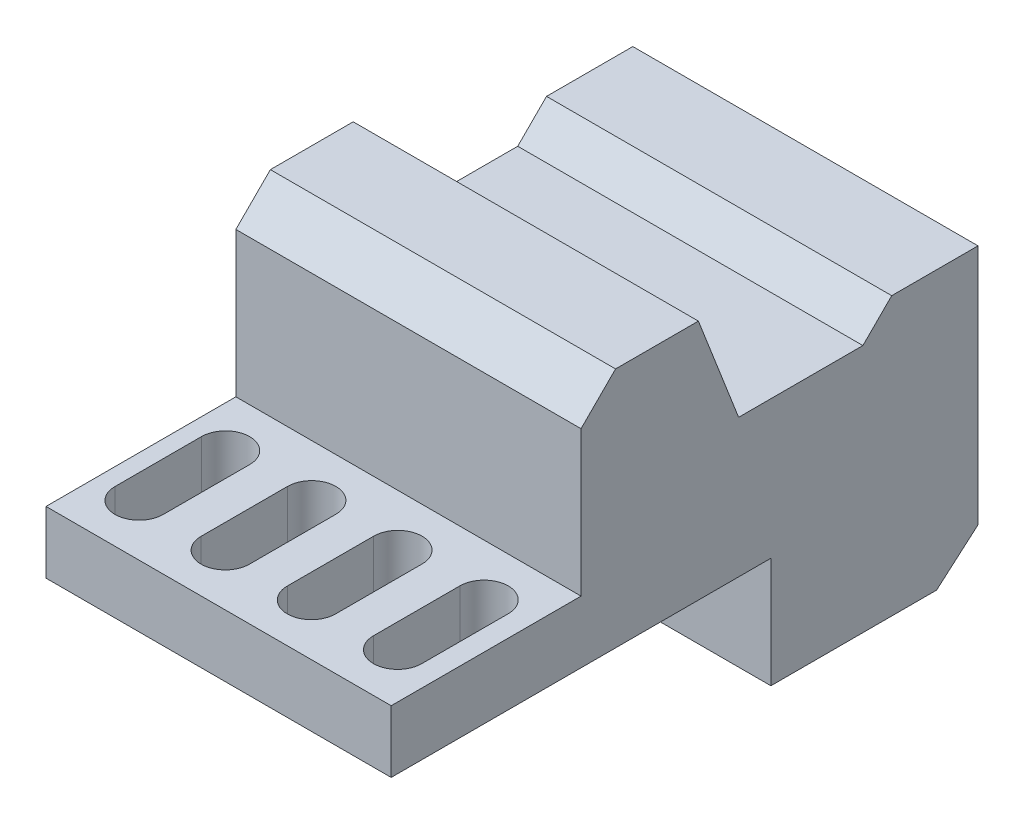
from build123d import *

# Parameters (mm, degrees)
RESSALTO_EXTRUS_O1_DEPTH = 100
CORTE_EXTRUS_O1_DEPTH    = 204.970201133


with BuildPart() as part:
    # Esboço3 → Ressalto-extrusão1 (new body)
    with BuildSketch(Plane(origin=(0, 0, 0), x_dir=(0, 0, -1), z_dir=(1, 0, 0))):
        Polygon((0, 0), (0, -70), (-12, -80.38), (-60, -80.38), (-60, -48.378489886), (-170, -48.378489886), (-170, -30.378489886), (-115, -30.378489886), (-115, 11.621510114), (-105.001510114, 21.62), (-81.001510114, 21.62), (-69.343860018, -8.343860018), (-33.343860018, -8.343860018), (-25, 0), align=None)
    extrude(amount=RESSALTO_EXTRUS_O1_DEPTH)

    # Esboço5 → Corte-extrusão1 (cut, through all)
    with BuildSketch(Plane(origin=(0, -30.378489886, 0), x_dir=(1, 0, 0), z_dir=(0, 1, 0))):
        with BuildLine():
            Line((5, -155.02), (5, -129.98))
            ThreePointArc((5, -129.98), (12, -122.98), (19, -129.98))
            Line((19, -129.98), (19, -155.02))
            ThreePointArc((19, -155.02), (12, -162.02), (5, -155.02))
        make_face()
        with BuildLine():
            Line((29.96, -155.02), (29.96, -129.98))
            ThreePointArc((29.96, -129.98), (36.96, -122.98), (43.96, -129.98))
            Line((43.96, -129.98), (43.96, -155.02))
            ThreePointArc((43.96, -155.02), (36.96, -162.02), (29.96, -155.02))
        make_face()
        with BuildLine():
            Line((54.92, -155.02), (54.92, -129.98))
            ThreePointArc((54.92, -129.98), (61.92, -122.98), (68.92, -129.98))
            Line((68.92, -129.98), (68.92, -155.02))
            ThreePointArc((68.92, -155.02), (61.92, -162.02), (54.92, -155.02))
        make_face()
        with BuildLine():
            Line((79.88, -155.02), (79.88, -129.98))
            ThreePointArc((79.88, -129.98), (86.88, -122.98), (93.88, -129.98))
            Line((93.88, -129.98), (93.88, -155.02))
            ThreePointArc((93.88, -155.02), (86.88, -162.02), (79.88, -155.02))
        make_face()
    extrude(amount=-CORTE_EXTRUS_O1_DEPTH, mode=Mode.SUBTRACT)


solid = part.part
